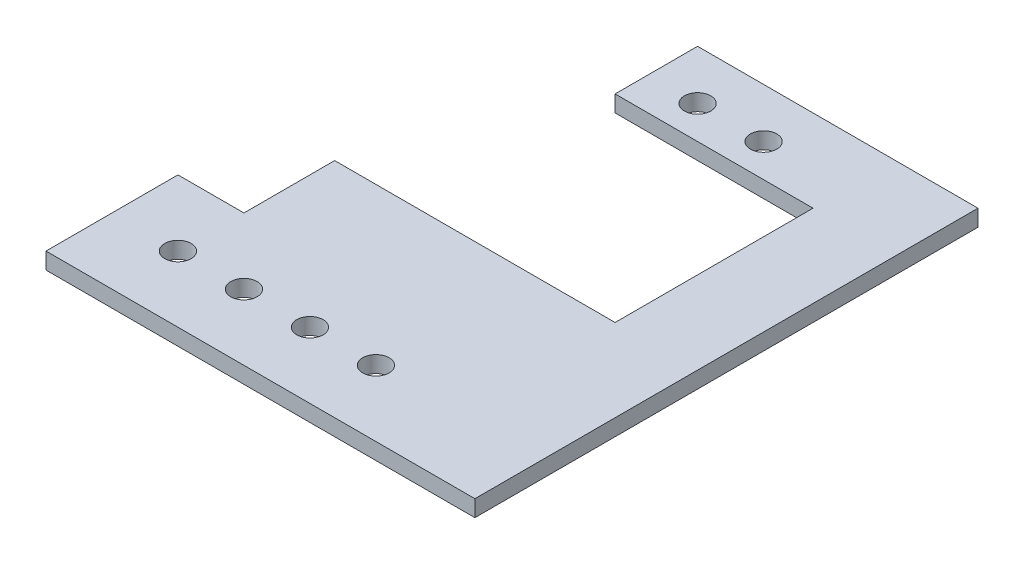
from build123d import *

# Parameters (mm, degrees)
SKETCH1_W          = 82.55
SKETCH1_H          = 96.8375
SKETCH1_W_2        = 38.1
SKETCH1_H_2        = 38.1
BASE_FLANGE2_DEPTH = 3.175
SKETCH3_W          = 12.7
SKETCH3_H          = 71.4375
CUT_EXTRUDE2_DEPTH = 128.287409162
SKETCH2_R          = 2.54
CUT_EXTRUDE1_DEPTH = 128.287409162
SKETCH5_W          = 15.875
SKETCH5_H          = 53.975
CUT_EXTRUDE6_DEPTH = 128.287409162
SKETCH7_R          = 2.54
CUT_EXTRUDE7_DEPTH = 128.287409162


# Sheet-metal steps are written as plain solids
with BuildPart() as part:
    # Base-Flange2: sheet metal written as solids
    # Sketch1 → Base-Flange2 (new body)
    with BuildSketch(Plane(origin=(0, 0, 0), x_dir=(1, 0, 0), z_dir=(0, 1, 0))):
        with Locations((41.275, 48.41875)):
            Rectangle(SKETCH1_W, SKETCH1_H)
        with Locations((47.625, 61.9125)):
            Rectangle(SKETCH1_W_2, SKETCH1_H_2, mode=Mode.SUBTRACT)
    extrude(amount=-BASE_FLANGE2_DEPTH)

    # Sketch3 → Cut-Extrude2 (cut, through all)
    with BuildSketch(Plane(origin=(0, 0, 0), x_dir=(1, 0, 0), z_dir=(0, 1, 0))):
        with Locations((6.35, 61.11875)):
            Rectangle(SKETCH3_W, SKETCH3_H)
    extrude(amount=-CUT_EXTRUDE2_DEPTH, mode=Mode.SUBTRACT)

    # Sketch2 → Cut-Extrude1 (cut, through all)
    with BuildSketch(Plane(origin=(0, 0, 0), x_dir=(1, 0, 0), z_dir=(0, 1, 0))):
        with Locations(Location((12.7, 12.7, 0), (0, 0, 270))):
            Circle(SKETCH2_R)
        with Locations(Location((25.4, 12.7, 0), (0, 0, 270))):
            Circle(SKETCH2_R)
        with Locations(Location((38.1, 12.7, 0), (0, 0, 270))):
            Circle(SKETCH2_R)
        with Locations(Location((50.8, 12.7, 0), (0, 0, 270))):
            Circle(SKETCH2_R)
    extrude(amount=-CUT_EXTRUDE1_DEPTH, mode=Mode.SUBTRACT)

    # Sketch5 → Cut-Extrude6 (cut, through all)
    with BuildSketch(Plane(origin=(0, 0, 0), x_dir=(1, 0, 0), z_dir=(0, 1, 0))):
        with Locations((20.6375, 69.85)):
            Rectangle(SKETCH5_W, SKETCH5_H)
    extrude(amount=-CUT_EXTRUDE6_DEPTH, mode=Mode.SUBTRACT)

    # Sketch7 → Cut-Extrude7 (cut, through all)
    with BuildSketch(Plane(origin=(0, 0, 0), x_dir=(1, 0, 0), z_dir=(0, 1, 0))):
        with Locations(Location((38.1, 87.3125, 0), (0, 0, 270))):
            Circle(SKETCH7_R)
        with Locations(Location((50.8, 87.3125, 0), (0, 0, 270))):
            Circle(SKETCH7_R)
    extrude(amount=-CUT_EXTRUDE7_DEPTH, mode=Mode.SUBTRACT)


solid = part.part
